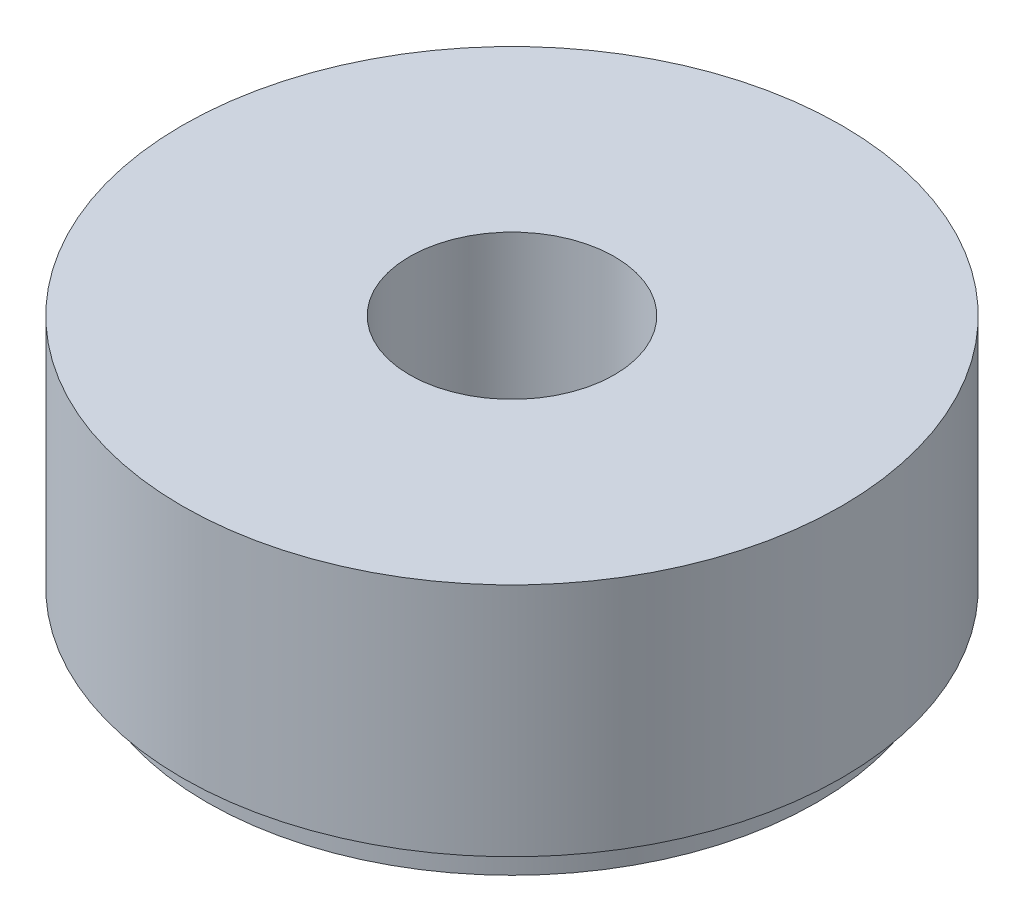
from build123d import *

# Parameters (mm, degrees)
SKETCH1_R           = 14.49
BOSS_EXTRUDE1_DEPTH = 2
SKETCH2_R           = 18.26
BOSS_EXTRUDE2_DEPTH = 2
SKETCH3_R           = 19.73
BOSS_EXTRUDE3_DEPTH = 14.09
CUT_EXTRUDE1_REACH  = 35.253
SKETCH4_R           = 6.13


with BuildPart() as part:
    # Sketch1 → Boss-Extrude1 (new body)
    with BuildSketch(Plane(origin=(0, 0, 0), x_dir=(1, 0, 0), z_dir=(0, 1, 0))):
        Circle(SKETCH1_R)
    extrude(amount=BOSS_EXTRUDE1_DEPTH)

    # Sketch2 → Boss-Extrude2 (add)
    with BuildSketch(Plane(origin=(0, 2, 0), x_dir=(1, 0, 0), z_dir=(0, 1, 0))):
        Circle(SKETCH2_R)
    extrude(amount=BOSS_EXTRUDE2_DEPTH)

    # Sketch3 → Boss-Extrude3 (add)
    with BuildSketch(Plane(origin=(0, 4, 0), x_dir=(1, 0, 0), z_dir=(0, 1, 0))):
        Circle(SKETCH3_R)
    extrude(amount=BOSS_EXTRUDE3_DEPTH)

    # Sketch4 → Cut-Extrude1 (cut, up to next)
    with BuildSketch(Plane.XZ, mode=Mode.PRIVATE) as cut_extrude1_sk1:
        Circle(SKETCH4_R)
    cut_extrude1_tool1 = extrude(cut_extrude1_sk1.sketch, amount=-CUT_EXTRUDE1_REACH, mode=Mode.PRIVATE) & part.part
    add(cut_extrude1_tool1.solids().sort_by_distance((0, 0, 0))[0], mode=Mode.SUBTRACT)


solid = part.part
